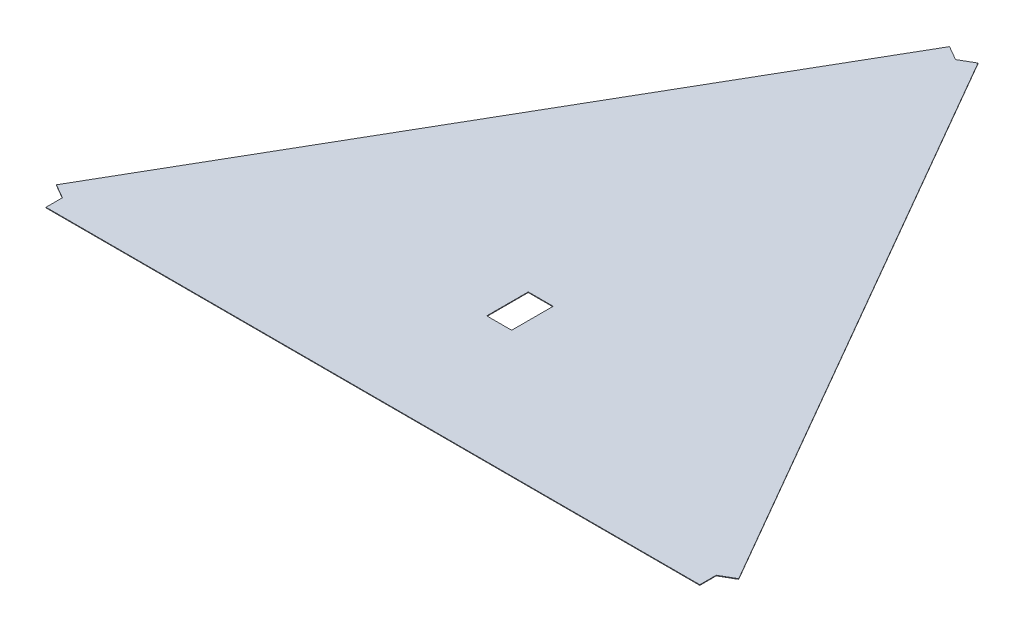
from build123d import *

# Parameters (mm, degrees)
SKETCH2_W           = 3000
SKETCH2_H           = 5000
BOSS_EXTRUDE6_DEPTH = 70


# Read off the part's stored shape, not the designer's step: Imported1
with BuildPart() as part:
    # Sketch2 → Boss-Extrude6 (new body)
    with BuildSketch(Plane(origin=(0, 29965.257644653, 0), x_dir=(1, 0, 0), z_dir=(0, 1, 0))):
        Polygon((87879.112243652, -80330.845336914), (9139.113426208, -80330.845336914), (9139.113426208, -78350.845336914), (7424.383086812, -77360.845406028), (46794.382972371, -9169.998962852), (48509.113311768, -10159.998893738), (50223.843661548, -9169.998980838), (89593.842593433, -77360.845424014), (87879.112243652, -78350.845336914), align=None)
        with Locations((48509.112944927, -62620.563189189)):
            Rectangle(SKETCH2_W, SKETCH2_H, mode=Mode.SUBTRACT)
    extrude(amount=BOSS_EXTRUDE6_DEPTH)


solid = part.part
